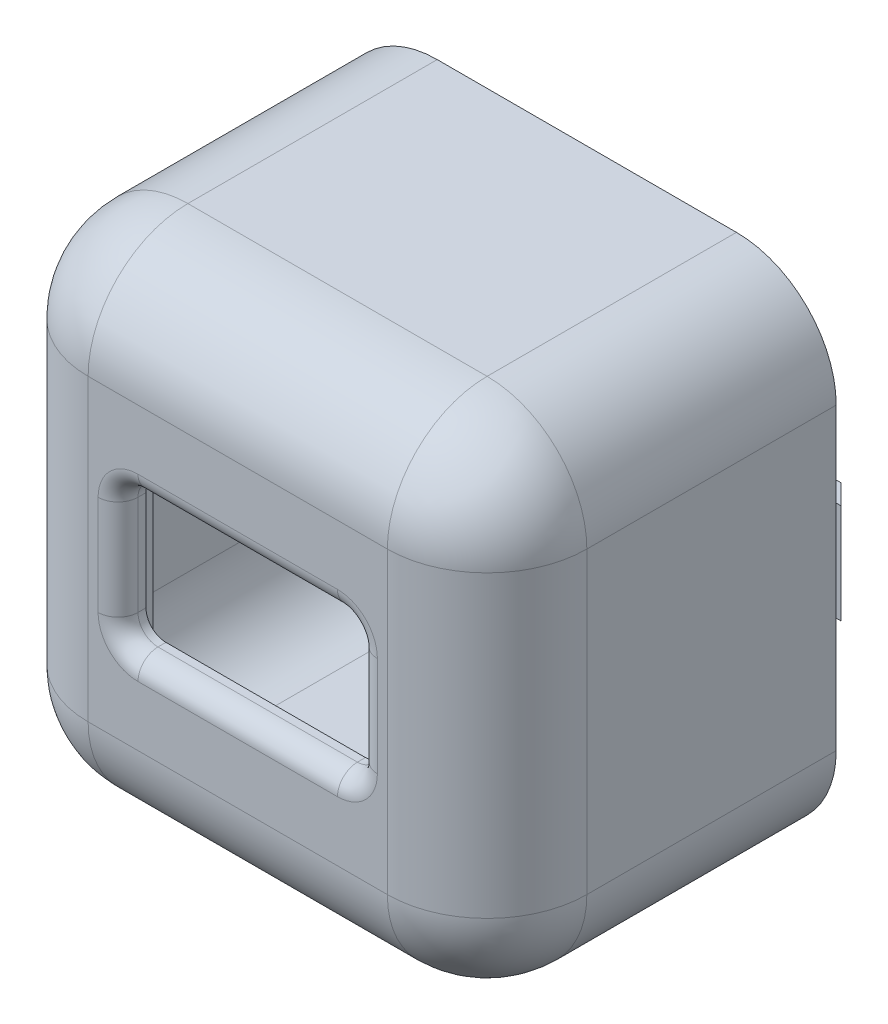
from build123d import *

# Parameters (mm, degrees)
SKETCH1_W                = 50
SKETCH1_H                = 50
BOSS_EXTRUDE1_DEPTH      = 45
FILLET1_R                = 10
SHELL1_T                 = -2
SKETCH2_W                = 24
SKETCH2_H                = 14
CUT_EXTRUDE1_DEPTH       = 10
SKETCH3_W                = 28
SKETCH3_H                = 18
BOSS_EXTRUDE2_DEPTH      = 2
SKETCH4_W                = 24
SKETCH4_H                = 14
CUT_EXTRUDE2_DEPTH       = 2
FILLET2_R                = 2
FILLET3_R                = 2
SKETCH5_W                = 28
SKETCH5_H                = 28
BOSS_EXTRUDE3_DEPTH      = 2
CUT_EXTRUDE4_DEPTH       = 2
SKETCH8_W                = 25
SKETCH8_H                = 17
CUT_EXTRUDE5_DEPTH       = 1.2
SKETCH9_W                = 28
SKETCH9_H                = 4
CUT_EXTRUDE6_DEPTH       = 1.2
CUT_EXTRUDE10_START      = -10
CUT_EXTRUDE10_DEPTH      = 10
SKETCH14_W               = 7
SKETCH14_H               = 10
BOSS_EXTRUDE4_DEPTH      = 3
SKETCH15_W               = 2
SKETCH15_H               = 10
BOSS_EXTRUDE5_DEPTH      = 1
CHAMFER1_SIZE            = 2
FILLET4_R                = 1
CHAMFER1_OF_MIRROR1_SIZE = 2
FILLET5_R                = 1


with BuildPart() as part:
    # Sketch1 → Boss-Extrude1 (new body)
    with BuildSketch(Plane.XY):
        Rectangle(SKETCH1_W, SKETCH1_H)
    extrude(amount=BOSS_EXTRUDE1_DEPTH)

    # Fillet1
    fillet1_edges = [part.edges().sort_by_distance(p)[0] for p in [
        (-25, 0, 45),
        (0, -25, 45),
        (25, 0, 45),
        (25, -25, 22.5),
        (-25, -25, 22.5),
        (-25, 25, 22.5),
        (25, 25, 22.5),
        (0, 25, 45),
    ]]
    fillet(fillet1_edges, radius=FILLET1_R)

    # Shell1
    shell1_openings = [part.faces().sort_by_distance(p)[0] for p in [
        (0, 0, 0),
    ]]
    offset(amount=SHELL1_T, openings=shell1_openings, kind=Kind.INTERSECTION)

    # Sketch2 → Cut-Extrude1 (cut)
    with BuildSketch(Plane(origin=(0, 0, 43), x_dir=(-1, 0, 0), z_dir=(0, 0, -1))):
        Rectangle(SKETCH2_W, SKETCH2_H)
    extrude(amount=-CUT_EXTRUDE1_DEPTH, mode=Mode.SUBTRACT)

    # Sketch3 → Boss-Extrude2 (add)
    with BuildSketch(Plane(origin=(0, 0, 43), x_dir=(-1, 0, 0), z_dir=(0, 0, -1))):
        Rectangle(SKETCH3_W, SKETCH3_H)
    extrude(amount=BOSS_EXTRUDE2_DEPTH)

    # Sketch4 → Cut-Extrude2 (cut)
    with BuildSketch(Plane.XY.offset(43)):
        Rectangle(SKETCH4_W, SKETCH4_H)
    extrude(amount=-CUT_EXTRUDE2_DEPTH, mode=Mode.SUBTRACT)

    # Fillet2
    fillet2_edges = [part.edges().sort_by_distance(p)[0] for p in [
        (-12, 7, 43),
        (-12, -7, 43),
        (12, -7, 43),
        (12, 7, 43),
    ]]
    fillet(fillet2_edges, radius=FILLET2_R)

    # Fillet3
    fillet3_edges = [part.edges().sort_by_distance(p)[0] for p in [
        (12, 0, 45),
        (0, 7, 45),
        (0, -7, 45),
        (-12, 0, 45),
        (11.414213562, 6.414213562, 45),
        (11.414213562, -6.414213562, 45),
        (-11.414213562, -6.414213562, 45),
        (-11.414213562, 6.414213562, 45),
    ]]
    fillet(fillet3_edges, radius=FILLET3_R)

    # Sketch5 → Boss-Extrude3 (add)
    with BuildSketch(Plane(origin=(0, 0, 41), x_dir=(-1, 0, 0), z_dir=(0, 0, -1))):
        Rectangle(SKETCH5_W, SKETCH5_H)
    extrude(amount=-BOSS_EXTRUDE3_DEPTH)

    # Sketch7 → Cut-Extrude4 (cut)
    with BuildSketch(Plane.XY.offset(43)):
        with BuildLine():
            Line((12, -5), (12, 5))
            ThreePointArc((12, 5), (11.414213562, 6.414213562), (10, 7))
            Line((10, 7), (-10, 7))
            ThreePointArc((-10, 7), (-11.414213562, 6.414213562), (-12, 5))
            Line((-12, 5), (-12, -5))
            ThreePointArc((-12, -5), (-11.414213562, -6.414213562), (-10, -7))
            Line((-10, -7), (10, -7))
            ThreePointArc((10, -7), (11.414213562, -6.414213562), (12, -5))
        make_face()
    extrude(amount=-CUT_EXTRUDE4_DEPTH, mode=Mode.SUBTRACT)

    # Sketch8 → Cut-Extrude5 (cut)
    with BuildSketch(Plane(origin=(0, 0, 41), x_dir=(-1, 0, 0), z_dir=(0, 0, -1))):
        Rectangle(SKETCH8_W, SKETCH8_H)
    extrude(amount=-CUT_EXTRUDE5_DEPTH, mode=Mode.SUBTRACT)

    # Sketch9 → Cut-Extrude6 (cut)
    with BuildSketch(Plane(origin=(0, 0, 41), x_dir=(-1, 0, 0), z_dir=(0, 0, -1))):
        with Locations((0, -12)):
            Rectangle(SKETCH9_W, SKETCH9_H)
    extrude(amount=-CUT_EXTRUDE6_DEPTH, mode=Mode.SUBTRACT)

    # Sketch13 → Cut-Extrude10 (cut)
    with BuildSketch(Plane(origin=(0, 0, 0), x_dir=(-1, 0, 0), z_dir=(0, 0, -1)).offset(CUT_EXTRUDE10_START)):
        with BuildLine():
            Line((-15, -25), (15, -25))
            ThreePointArc((15, -25), (22.071067812, -22.071067812), (25, -15))
            Line((25, -15), (25, 15))
            ThreePointArc((25, 15), (22.071067812, 22.071067812), (15, 25))
            Line((15, 25), (-15, 25))
            ThreePointArc((-15, 25), (-22.071067812, 22.071067812), (-25, 15))
            Line((-25, 15), (-25, -15))
            ThreePointArc((-25, -15), (-22.071067812, -22.071067812), (-15, -25))
        make_face()
    extrude(amount=CUT_EXTRUDE10_DEPTH, mode=Mode.SUBTRACT)

    # Sketch14 → Boss-Extrude4 (add)
    with BuildSketch(Plane(origin=(-23, 0, 0), x_dir=(0, 0, -1), z_dir=(1, 0, 0))):
        with Locations((-10, 0)):
            Rectangle(SKETCH14_W, SKETCH14_H)
    boss_extrude4 = extrude(amount=BOSS_EXTRUDE4_DEPTH)

    # Sketch15 → Boss-Extrude5 (add)
    with BuildSketch(Plane.ZY.offset(23)):
        with Locations((7.5, 0)):
            Rectangle(SKETCH15_W, SKETCH15_H)
    boss_extrude5 = extrude(amount=BOSS_EXTRUDE5_DEPTH)

    # Chamfer1
    chamfer1_edges = [part.edges().sort_by_distance(p)[0] for p in [
        (-24, 0, 6.5),
    ]]
    chamfer(chamfer1_edges, length=CHAMFER1_SIZE - 0.0001)  # a hair under: the kernel refuses the full size

    # Fillet4
    fillet4_edges = [part.edges().sort_by_distance(p)[0] for p in [
        (-23, 5, 11.75),
        (-23, 0, 13.5),
        (-23, -5, 11.75),
        (-20, 0, 13.5),
    ]]
    fillet(fillet4_edges, radius=FILLET4_R)

    # Mirror1: Boss-Extrude4, Boss-Extrude5 across plane
    add(boss_extrude4.mirror(Plane(origin=(0, 0, 0), x_dir=(0, 0, 1), z_dir=(1, 0, 0))))
    add(boss_extrude5.mirror(Plane(origin=(0, 0, 0), x_dir=(0, 0, 1), z_dir=(1, 0, 0))))

    # Chamfer1 of Mirror1
    chamfer1_of_mirror1_edges = [part.edges().sort_by_distance(p)[0] for p in [
        (24, 0, 6.5),
    ]]
    chamfer(chamfer1_of_mirror1_edges, length=CHAMFER1_OF_MIRROR1_SIZE - 0.0001)  # a hair under: the kernel refuses the full size

    # Fillet5
    fillet5_edges = [part.edges().sort_by_distance(p)[0] for p in [
        (23, 5, 11.75),
        (23, 0, 13.5),
        (23, -5, 11.75),
        (20, 0, 13.5),
    ]]
    fillet(fillet5_edges, radius=FILLET5_R)


solid = part.part
